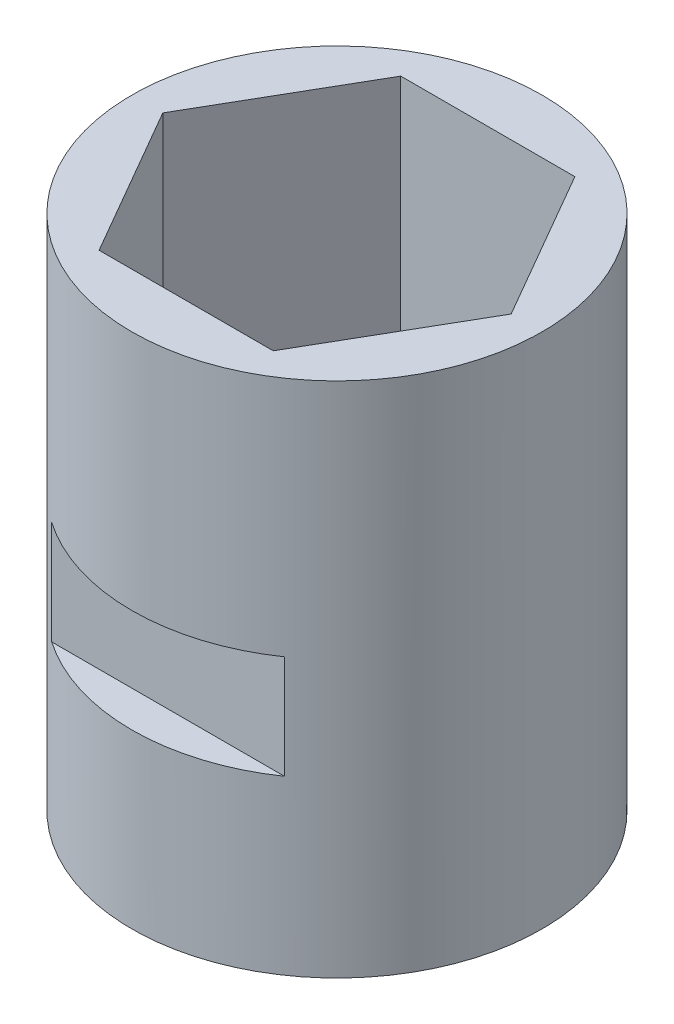
from build123d import *

# Parameters (mm, degrees)
SKETCH1_R               = 7.5565
BOSS_EXTRUDE1_DEPTH     = 15.875
BOSS_EXTRUDE2_START     = 3.175
SKETCH2_R               = 7.5565
SKETCH2_R_2             = 3.3782
BOSS_EXTRUDE2_DEPTH     = 3.175
CUT_EXTRUDE1_DEPTH      = 20.136797263
CUT_EXTRUDE1_DEPTH_BACK = 20.136797263
SKETCH3_W               = 1.979009817
SKETCH3_H               = 3.81
SKETCH3_W_2             = 2.256055482


with BuildPart() as part:
    # Sketch1 → Boss-Extrude1 (new body)
    with BuildSketch(Plane(origin=(0, 0, 0), x_dir=(1, 0, 0), z_dir=(0, 1, 0))):
        Circle(SKETCH1_R)
        Polygon((-3.207902433, 5.55625), (-6.415804866, 0), (-3.207902433, -5.55625), (3.207902433, -5.55625), (6.415804866, 0), (3.207902433, 5.55625), align=None, mode=Mode.SUBTRACT)
    extrude(amount=BOSS_EXTRUDE1_DEPTH)

    # Sketch2 → Boss-Extrude2 (add)
    with BuildSketch(Plane.XZ.offset(BOSS_EXTRUDE2_START)):
        Circle(SKETCH2_R)
        Circle(SKETCH2_R_2, mode=Mode.SUBTRACT)
    extrude(amount=-BOSS_EXTRUDE2_DEPTH)

    # Sketch3 → Cut-Extrude1 (cut, two sides: drawn at the far end of the back side and taken through both)
    with BuildSketch(Plane(origin=(0, 0, 0), x_dir=(0, 0, -1), z_dir=(1, 0, 0)).offset(-CUT_EXTRUDE1_DEPTH_BACK)):
        with Locations((-7.212504909, 5.08)):
            Rectangle(SKETCH3_W, SKETCH3_H)
        with Locations((7.351027741, 5.08)):
            Rectangle(SKETCH3_W_2, SKETCH3_H)
    extrude(amount=CUT_EXTRUDE1_DEPTH + CUT_EXTRUDE1_DEPTH_BACK, mode=Mode.SUBTRACT)


solid = part.part
